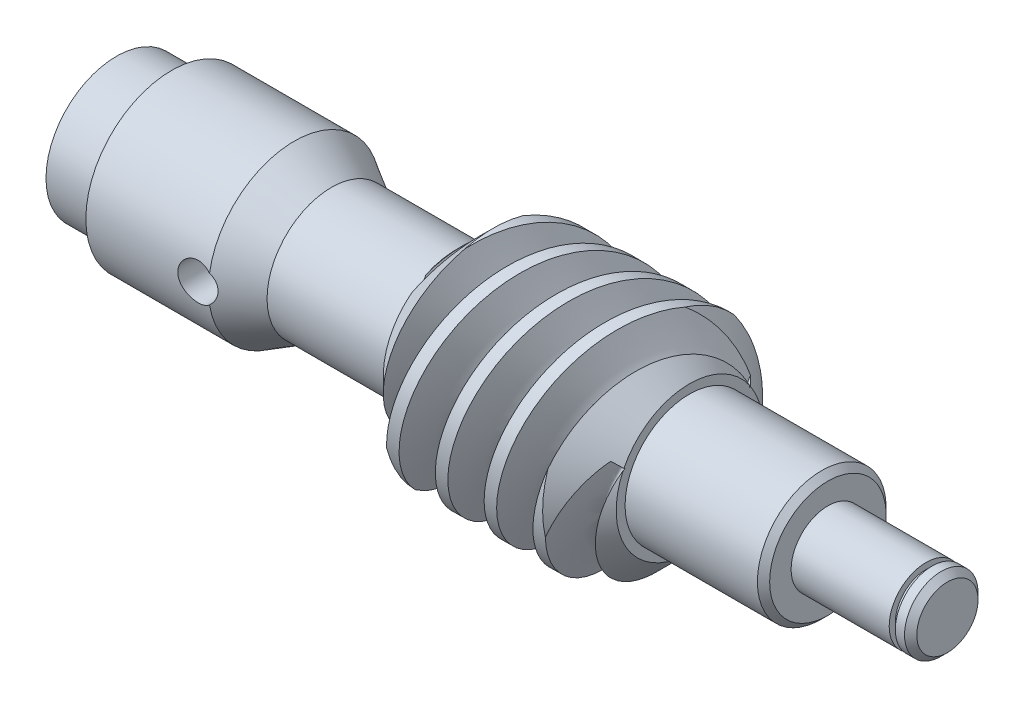
from build123d import *

# Parameters (mm, degrees)
ENL_VEMENT_DE_MATI_RE_BALAYAGE1_PITCH             = 23.8761
R_P_TITION_CIRCULAIRE1_COUNT                      = 3
DIAM_TRE_DU_PER_AGE_M14_0_14_000000_1_D           = 14
DIAM_TRE_DU_PER_AGE_M14_0_14_000000_1_DEPTH       = 30
DIAM_TRE_DU_PER_AGE_M14_0_14_000000_1_CSINK_D     = 15
DIAM_TRE_DU_PER_AGE_M14_0_14_000000_1_CSINK_ANGLE = 90
DIAM_TRE_DU_PER_AGE_M14_0_14_000000_1_TIP         = 4.206024333
ESQUISSE13_R                                      = 3
ENL_V_MAT_EXTRU_1_DEPTH                           = 138.918487068
ESQUISSE14_W                                      = 27
ESQUISSE14_H                                      = 5
ENL_V_MAT_EXTRU_2_DEPTH                           = 9


with BuildPart() as part:
    # Esquisse1 → Base-Révolution (revolve)
    with BuildSketch(Plane.XY, mode=Mode.PRIVATE) as base_r_volution_sk:
        Polygon((0, 0), (0, 11.5), (9, 11.5), (9, 14), (29, 14), (35.062177826, 10.5), (55.472177826, 10.5), (55.472177826, 11.95), (61.472177826, 17.95), (87.472177826, 17.95), (93.472177826, 11.95), (93.472177826, 10.5), (115.062177826, 10.5), (116.062177826, 9.5), (116.062177826, 6), (132.062177826, 6), (132.062177826, 5), (133.062177826, 5), (133.062177826, 6), (134.562177826, 6), (135.562177826, 5), (135.562177826, 0), align=None)
    revolve(base_r_volution_sk.sketch.rotate(Axis((-14.989318239, 0, 0), (1, 0, 0)), 90), axis=Axis((-14.989318239, 0, 0), (1, 0, 0)))

    # Enlèvement de matière-Balayage1: the profile of Esquisse5 screwed along a left-hand helix of 2 turns, 20 arcs to a turn; built about Z, then put on its axis
    enl_vement_de_mati_re_balayage1_z = Axis((0, 0, 0), (0, 0, 1))
    enl_vement_de_mati_re_balayage1_corners = [(18, -0.026319322, -0.110818219), (18, -0.222944107, -0.938712194), (21, -0.222944107, -0.938712194), (21, 1.523662787, 6.415423381), (18, 1.523662787, 6.415423381), (18, 1.327038002, 5.587529406), (16, 1.135611364, 4.781522369), (11.599284268, 0.714404256, 3.008018446), (11.414089298, 0.65035934, 2.738355594), (11.599284268, 0.586314424, 2.468692741), (16, 0.165107315, 0.695188818)]
    with BuildLine(mode=Mode.PRIVATE) as enl_vement_de_mati_re_balayage1_profile:
        Line(enl_vement_de_mati_re_balayage1_corners[0], enl_vement_de_mati_re_balayage1_corners[1])
        Line(enl_vement_de_mati_re_balayage1_corners[1], enl_vement_de_mati_re_balayage1_corners[2])
        Line(enl_vement_de_mati_re_balayage1_corners[2], enl_vement_de_mati_re_balayage1_corners[3])
        Line(enl_vement_de_mati_re_balayage1_corners[3], enl_vement_de_mati_re_balayage1_corners[4])
        Line(enl_vement_de_mati_re_balayage1_corners[4], enl_vement_de_mati_re_balayage1_corners[5])
        Line(enl_vement_de_mati_re_balayage1_corners[5], enl_vement_de_mati_re_balayage1_corners[6])
        Line(enl_vement_de_mati_re_balayage1_corners[6], enl_vement_de_mati_re_balayage1_corners[7])
        Line(enl_vement_de_mati_re_balayage1_corners[9], enl_vement_de_mati_re_balayage1_corners[10])
        Line(enl_vement_de_mati_re_balayage1_corners[10], enl_vement_de_mati_re_balayage1_corners[0])
        ThreePointArc((11.599284268, 0.714404256, 3.008018446), (11.464648414, 0.688872423, 2.900515971), (11.414089298, 0.65035934, 2.738355594))
        ThreePointArc((11.414089298, 0.65035934, 2.738355594), (11.464648414, 0.611846257, 2.576195216), (11.599284268, 0.586314424, 2.468692741))
    enl_vement_de_mati_re_balayage1_cap = Face(enl_vement_de_mati_re_balayage1_profile.wire())
    enl_vement_de_mati_re_balayage1_arcs = [((11.599284268, 0.714404256, 3.008018446), (11.414089298, 0.696678631, 2.933384221), (11.414089298, 0.65035934, 2.738355594), (1, 0.8314696123025435, 1)), ((11.414089298, 0.65035934, 2.738355594), (11.414089298, 0.604040049, 2.543326966), (11.599284268, 0.586314424, 2.468692741), (1, 0.8314696123025435, 1))]  # start, shoulder, end, weights
    enl_vement_de_mati_re_balayage1_turn_angles = [0, -9, -18, -27, -36, -45, -54, -63, -72, -81, -90, -99, -108, -117, -126, -135, -144, -153, -162, -171, -180, -189, -198, -207, -216, -225, -234, -243, -252, -261, -270, -279, -288, -297, -306, -315, -324, -333, -342, -351, -360]
    enl_vement_de_mati_re_balayage1_turn_weights = [1, 0.9876883405951378, 1, 0.9876883405951378, 1, 0.9876883405951378, 1, 0.9876883405951378, 1, 0.9876883405951378, 1, 0.9876883405951378, 1, 0.9876883405951378, 1, 0.9876883405951378, 1, 0.9876883405951378, 1, 0.9876883405951378, 1, 0.9876883405951378, 1, 0.9876883405951378, 1, 0.9876883405951378, 1, 0.9876883405951378, 1, 0.9876883405951378, 1, 0.9876883405951378, 1, 0.9876883405951378, 1, 0.9876883405951378, 1, 0.9876883405951378, 1, 0.9876883405951378, 1]
    enl_vement_de_mati_re_balayage1_turn_rails = [Edge.make_bspline([Vector(p[0], p[1], 0).rotate(enl_vement_de_mati_re_balayage1_z, enl_vement_de_mati_re_balayage1_turn_angles[k]) / enl_vement_de_mati_re_balayage1_turn_weights[k] + Vector(0, 0, p[2] + -ENL_VEMENT_DE_MATI_RE_BALAYAGE1_PITCH * enl_vement_de_mati_re_balayage1_turn_angles[k] / 360) for k in range(41)], [0, 0, 0, 1, 1, 2, 2, 3, 3, 4, 4, 5, 5, 6, 6, 7, 7, 8, 8, 9, 9, 10, 10, 11, 11, 12, 12, 13, 13, 14, 14, 15, 15, 16, 16, 17, 17, 18, 18, 19, 19, 20, 20, 20], 2, enl_vement_de_mati_re_balayage1_turn_weights) for p in enl_vement_de_mati_re_balayage1_corners]
    enl_vement_de_mati_re_balayage1_turn_sides = [*[Face.make_surface_from_curves(enl_vement_de_mati_re_balayage1_turn_rails[p[0]], enl_vement_de_mati_re_balayage1_turn_rails[p[1]]) for p in [(0, 1), (1, 2), (2, 3), (3, 4), (4, 5), (5, 6), (6, 7), (9, 10), (10, 0)]], *[Face.make_bezier_surface([[Vector(p[j][0], p[j][1], 0).rotate(enl_vement_de_mati_re_balayage1_z, enl_vement_de_mati_re_balayage1_turn_angles[2 * i + k]) / enl_vement_de_mati_re_balayage1_turn_weights[2 * i + k] + Vector(0, 0, p[j][2] + -ENL_VEMENT_DE_MATI_RE_BALAYAGE1_PITCH * enl_vement_de_mati_re_balayage1_turn_angles[2 * i + k] / 360) for k in range(3)] for j in range(3)], [[p[3][j] * enl_vement_de_mati_re_balayage1_turn_weights[2 * i + k] for k in range(3)] for j in range(3)]) for p in enl_vement_de_mati_re_balayage1_arcs for i in range(20)]]
    enl_vement_de_mati_re_balayage1 = Plane(origin=(42.66, 0, 0), x_dir=(0, -1, 0), z_dir=(1, 0, 0)) * Solid(Shell([*[p.moved(Location((0, 0, ENL_VEMENT_DE_MATI_RE_BALAYAGE1_PITCH * i))) for i in range(2) for p in enl_vement_de_mati_re_balayage1_turn_sides], enl_vement_de_mati_re_balayage1_cap, enl_vement_de_mati_re_balayage1_cap.rotate(enl_vement_de_mati_re_balayage1_z, -720).moved(Location((0, 0, -ENL_VEMENT_DE_MATI_RE_BALAYAGE1_PITCH * -720 / 360)))]))
    add(enl_vement_de_mati_re_balayage1, mode=Mode.SUBTRACT)

    # Répétition circulaire1: Enlèvement de matière-Balayage1 ×3 about axis
    r_p_tition_circulaire1_axis = Axis((50, 0, 0), (-1, 0, 0))
    for i in range(1, R_P_TITION_CIRCULAIRE1_COUNT):
        add(enl_vement_de_mati_re_balayage1.rotate(r_p_tition_circulaire1_axis, i * 360 / R_P_TITION_CIRCULAIRE1_COUNT), mode=Mode.SUBTRACT)

    # Diamètre du perçage M14.0 (14.000000)1
    with Locations(Plane.ZY):
        with Locations((0, 0)):
            CounterSinkHole(DIAM_TRE_DU_PER_AGE_M14_0_14_000000_1_D / 2, DIAM_TRE_DU_PER_AGE_M14_0_14_000000_1_CSINK_D / 2, depth=DIAM_TRE_DU_PER_AGE_M14_0_14_000000_1_DEPTH, counter_sink_angle=DIAM_TRE_DU_PER_AGE_M14_0_14_000000_1_CSINK_ANGLE)
            with Locations((0, 0, -(DIAM_TRE_DU_PER_AGE_M14_0_14_000000_1_DEPTH + DIAM_TRE_DU_PER_AGE_M14_0_14_000000_1_TIP / 2))):  # 118° drill point
                Cone(0, DIAM_TRE_DU_PER_AGE_M14_0_14_000000_1_D / 2, DIAM_TRE_DU_PER_AGE_M14_0_14_000000_1_TIP, mode=Mode.SUBTRACT)

    # Esquisse13 → Enlèv. mat.-Extru.1 (cut, through all)
    with BuildSketch(Plane.XY):
        with Locations(Location((27, 0, 0), (0, 0, 236.442690238))):
            Circle(ESQUISSE13_R)
    extrude(amount=ENL_V_MAT_EXTRU_1_DEPTH, mode=Mode.SUBTRACT)

    # Esquisse14 → Enlèv. mat.-Extru.2 (cut)
    with BuildSketch(Plane.XY):
        with Locations((13.5, 0)):
            Rectangle(ESQUISSE14_W, ESQUISSE14_H)
    extrude(amount=ENL_V_MAT_EXTRU_2_DEPTH, mode=Mode.SUBTRACT)


solid = part.part
